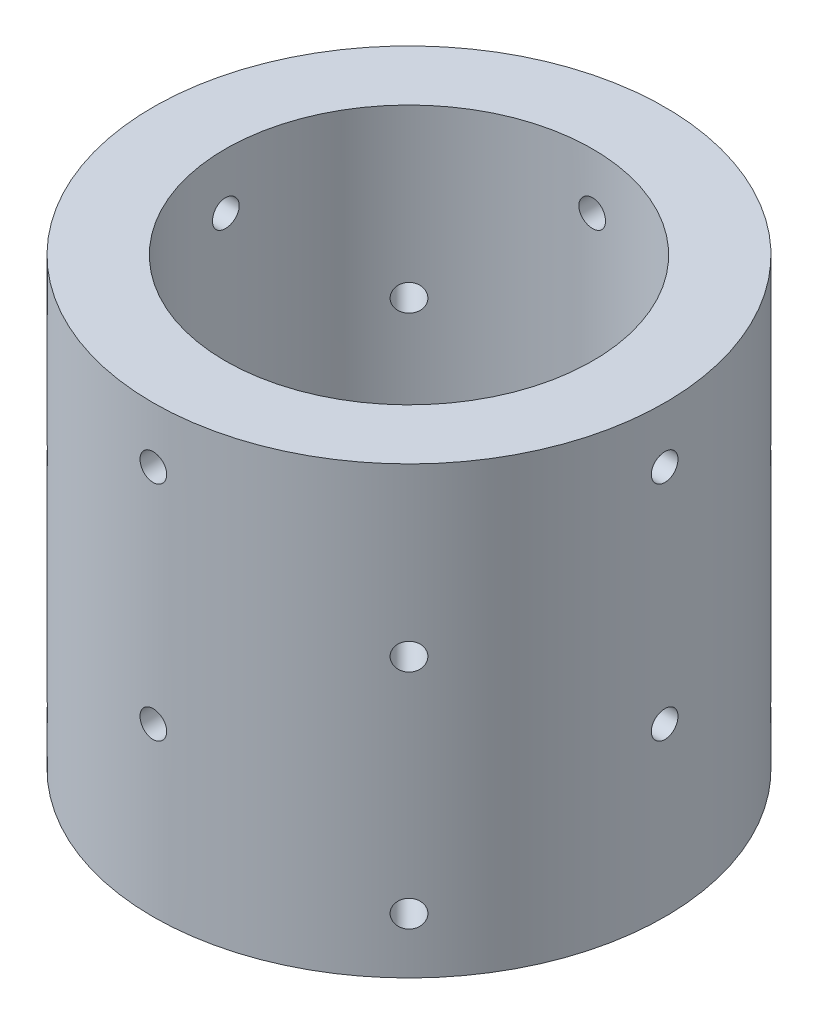
from build123d import *

# Parameters (mm, degrees)
SKETCH_1_R                       = 23
EXTRUDE_1_DEPTH                  = 5
SKETCH_2_R                       = 23
SKETCH_2_R_2                     = 16.5
EXTRUDE_2_DEPTH                  = 35
SKETCH_3_R                       = 1.2
CUT_EXTRUDE_1_DEPTH              = 52.555795019
CUT_EXTRUDE_START                = -16.3
SKETCH_4_R                       = 1.2
CUT_EXTRUDE_2_DEPTH              = 36.255795185
PATTERN_CIRCULAR_1_COUNT         = 4
PATTERN_CIRCULAR_2_COUNT         = 4
PATTERN_START                    = -16.3
PATTERN_LINEAR_3_COPY_1_SKETCH_R = 1.2
PATTERN_LINEAR_3_COPY_1_DEPTH    = 36.255795185
PATTERN_LINEAR_3_COPY_2_SKETCH_R = 1.2
PATTERN_LINEAR_3_COPY_2_DEPTH    = 36.255795185
PATTERN_LINEAR_3_COPY_3_SKETCH_R = 1.2
PATTERN_LINEAR_3_COPY_3_DEPTH    = 36.255795185
PATTERN_LINEAR_3_COPY_4_SKETCH_R = 1.2
PATTERN_LINEAR_3_COPY_4_DEPTH    = 36.255795185
PATTERN_LINEAR_4_COPY_1_SKETCH_R = 1.2
PATTERN_LINEAR_4_COPY_1_DEPTH    = 52.555795019
PATTERN_LINEAR_4_COPY_2_SKETCH_R = 1.2
PATTERN_LINEAR_4_COPY_2_DEPTH    = 52.555795019
PATTERN_LINEAR_4_COPY_3_SKETCH_R = 1.2
PATTERN_LINEAR_4_COPY_3_DEPTH    = 52.555795019
PATTERN_LINEAR_4_COPY_4_SKETCH_R = 1.2
PATTERN_LINEAR_4_COPY_4_DEPTH    = 52.555795019


with BuildPart() as part:
    # Эскиз1 → Бобышка-Вытянуть1 (new body)
    with BuildSketch(Plane(origin=(0, 0, 0), x_dir=(1, 0, 0), z_dir=(0, 1, 0))):
        Circle(SKETCH_1_R)
    extrude(amount=EXTRUDE_1_DEPTH)

    # Эскиз2 → Бобышка-Вытянуть2 (add)
    with BuildSketch(Plane(origin=(0, 5, 0), x_dir=(1, 0, 0), z_dir=(0, 1, 0))):
        Circle(SKETCH_2_R)
        Circle(SKETCH_2_R_2, mode=Mode.SUBTRACT)
    extrude(amount=EXTRUDE_2_DEPTH)

    # Эскиз3 → Вырез-Вытянуть1 (cut, through all)
    with BuildSketch(Plane(origin=(0, 0, 0), x_dir=(0, 0, -1), z_dir=(1, 0, 0))):
        with Locations((0, 35)):
            Circle(SKETCH_3_R)
    cut_extrude_1 = extrude(amount=-CUT_EXTRUDE_1_DEPTH, mode=Mode.SUBTRACT)

    # Эскиз4 → Вырез-Вытянуть2 (cut, through all)
    with BuildSketch(Plane(origin=(0, 0, 0), x_dir=(0, -1, 0), z_dir=(0.7071067811865464, 0, 0.7071067811865488)).offset(CUT_EXTRUDE_START)):
        with Locations((-5, 0)):
            Circle(SKETCH_4_R)
    cut_extrude_2 = extrude(amount=-CUT_EXTRUDE_2_DEPTH, mode=Mode.SUBTRACT)

    # Круговой массив1: Вырез-Вытянуть2 ×4 about axis
    pattern_circular_1_axis = Axis((0, 5, 0), (0, -1, 0))
    for i in range(1, PATTERN_CIRCULAR_1_COUNT):
        add(cut_extrude_2.rotate(pattern_circular_1_axis, i * 360 / PATTERN_CIRCULAR_1_COUNT), mode=Mode.SUBTRACT)

    # Круговой массив2: Вырез-Вытянуть1 ×4 about axis
    pattern_circular_2_axis = Axis((0, 5, 0), (0, -1, 0))
    for i in range(1, PATTERN_CIRCULAR_2_COUNT):
        add(cut_extrude_1.rotate(pattern_circular_2_axis, i * 360 / PATTERN_CIRCULAR_2_COUNT), mode=Mode.SUBTRACT)

    # Линейный массив3 copy 1 sketch → Линейный массив3 copy 1 (cut, through all)
    with BuildSketch(Plane(origin=(0, 20, 0), x_dir=(0, -1, 0), z_dir=(-0.7071067811865488, 0, 0.7071067811865464)).offset(PATTERN_START)):
        with Locations((-5, 0)):
            Circle(PATTERN_LINEAR_3_COPY_1_SKETCH_R)
    extrude(amount=-PATTERN_LINEAR_3_COPY_1_DEPTH, mode=Mode.SUBTRACT)

    # Линейный массив3 copy 2 sketch → Линейный массив3 copy 2 (cut, through all)
    with BuildSketch(Plane(origin=(0, 20, 0), x_dir=(0, -1, 0), z_dir=(-0.7071067811865465, 0, -0.7071067811865487)).offset(PATTERN_START)):
        with Locations((-5, 0)):
            Circle(PATTERN_LINEAR_3_COPY_2_SKETCH_R)
    extrude(amount=-PATTERN_LINEAR_3_COPY_2_DEPTH, mode=Mode.SUBTRACT)

    # Линейный массив3 copy 3 sketch → Линейный массив3 copy 3 (cut, through all)
    with BuildSketch(Plane(origin=(0, 20, 0), x_dir=(0, -1, 0), z_dir=(0.7071067811865487, 0, -0.7071067811865465)).offset(PATTERN_START)):
        with Locations((-5, 0)):
            Circle(PATTERN_LINEAR_3_COPY_3_SKETCH_R)
    extrude(amount=-PATTERN_LINEAR_3_COPY_3_DEPTH, mode=Mode.SUBTRACT)

    # Линейный массив3 copy 4 sketch → Линейный массив3 copy 4 (cut, through all)
    with BuildSketch(Plane(origin=(0, 20, 0), x_dir=(0, -1, 0), z_dir=(0.7071067811865464, 0, 0.7071067811865488)).offset(PATTERN_START)):
        with Locations((-5, 0)):
            Circle(PATTERN_LINEAR_3_COPY_4_SKETCH_R)
    extrude(amount=-PATTERN_LINEAR_3_COPY_4_DEPTH, mode=Mode.SUBTRACT)

    # Линейный массив4 copy 1 sketch → Линейный массив4 copy 1 (cut, through all)
    with BuildSketch(Plane(origin=(0, -20, 0), x_dir=(1, 0, 0), z_dir=(0, 0, 1))):
        with Locations((0, 35)):
            Circle(PATTERN_LINEAR_4_COPY_1_SKETCH_R)
    extrude(amount=-PATTERN_LINEAR_4_COPY_1_DEPTH, mode=Mode.SUBTRACT)

    # Линейный массив4 copy 2 sketch → Линейный массив4 copy 2 (cut, through all)
    with BuildSketch(Plane(origin=(0, -20, 0), x_dir=(0, 0, 1), z_dir=(-1, 0, 0))):
        with Locations((0, 35)):
            Circle(PATTERN_LINEAR_4_COPY_2_SKETCH_R)
    extrude(amount=-PATTERN_LINEAR_4_COPY_2_DEPTH, mode=Mode.SUBTRACT)

    # Линейный массив4 copy 3 sketch → Линейный массив4 copy 3 (cut, through all)
    with BuildSketch(Plane(origin=(0, -20, 0), x_dir=(-1, 0, 0), z_dir=(0, 0, -1))):
        with Locations((0, 35)):
            Circle(PATTERN_LINEAR_4_COPY_3_SKETCH_R)
    extrude(amount=-PATTERN_LINEAR_4_COPY_3_DEPTH, mode=Mode.SUBTRACT)

    # Линейный массив4 copy 4 sketch → Линейный массив4 copy 4 (cut, through all)
    with BuildSketch(Plane(origin=(0, -20, 0), x_dir=(0, 0, -1), z_dir=(1, 0, 0))):
        with Locations((0, 35)):
            Circle(PATTERN_LINEAR_4_COPY_4_SKETCH_R)
    extrude(amount=-PATTERN_LINEAR_4_COPY_4_DEPTH, mode=Mode.SUBTRACT)


solid = part.part
